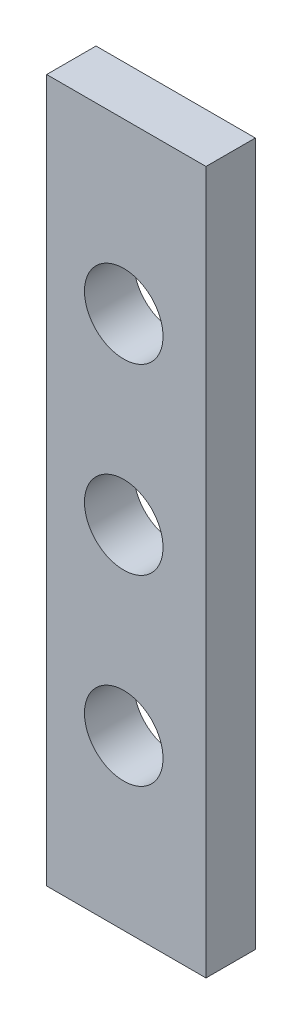
from build123d import *

# Parameters (mm, degrees)
SKETCH_1_W                = 8.718422396
SKETCH_1_H                = 38.462613559
EXTRUDE_1_DEPTH           = 2.7
HOLE_WIZARD_1_D           = 4.3
HOLE_WIZARD_1_DEPTH       = 19
HOLE_WIZARD_1_CSINK_D     = 8
HOLE_WIZARD_1_CSINK_ANGLE = 90
HOLE_WIZARD_1_TIP         = 1.291850331


with BuildPart() as part:
    # 草图1 → 凸台-拉伸1 (new body)
    with BuildSketch(Plane.XY):
        with Locations((-125.640788802, -85.768693221)):
            Rectangle(SKETCH_1_W, SKETCH_1_H)
    extrude(amount=EXTRUDE_1_DEPTH)

    # 打孔尺寸(%根据十字)槽沉头木螺钉的类型1
    with Locations(Plane(origin=(40.491378875, -131.010130877, 7.000000001), x_dir=(0, 1, 0), z_dir=(0, 0, 1))):
        with Locations((35.241437657, 166.27295648), (45.241437657, 166.27295648), (55.241437657, 166.27295648), (206.778824098, 166.27295648), (216.778824098, 166.27295648), (226.778824098, 166.27295648)):
            CounterSinkHole(HOLE_WIZARD_1_D / 2, HOLE_WIZARD_1_CSINK_D / 2, depth=HOLE_WIZARD_1_DEPTH, counter_sink_angle=HOLE_WIZARD_1_CSINK_ANGLE)
            with Locations((0, 0, -(HOLE_WIZARD_1_DEPTH + HOLE_WIZARD_1_TIP / 2))):  # 118° drill point
                Cone(0, HOLE_WIZARD_1_D / 2, HOLE_WIZARD_1_TIP, mode=Mode.SUBTRACT)


solid = part.part
